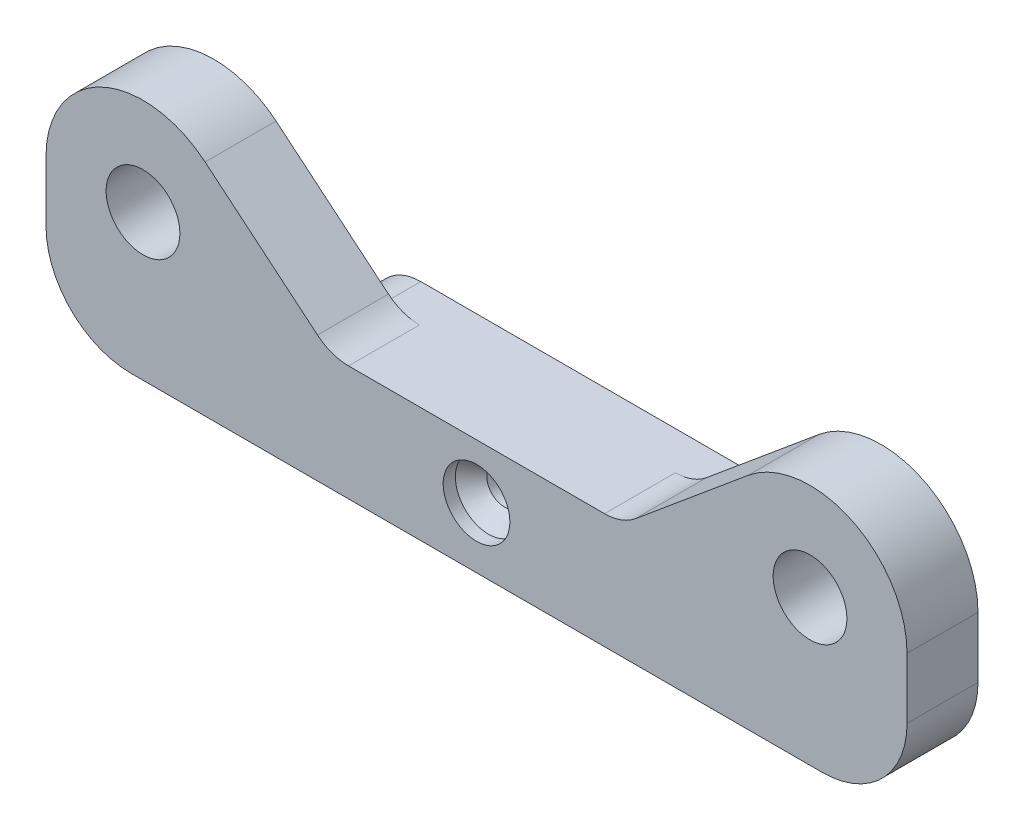
from build123d import *
from build123d.topology import SkipClean

# Parameters (mm, degrees)
BOSS_EXTRUDE1_DEPTH          = 9
BOSS_EXTRUDE1_DEPTH_BACK     = 9
SKETCH1_W                    = 67.5
SKETCH1_H                    = 7
SKETCH2_W                    = 15
SKETCH2_H                    = 6.3
CUT_EXTRUDE1_DEPTH           = 36.623903492
SKETCH3_W                    = 12.5
SKETCH3_H                    = 5.85
BOSS_EXTRUDE2_DEPTH          = 10
CUT_EXTRUDE2_DEPTH           = 22
CUT_EXTRUDE2_DEPTH_BACK      = 24.5
SKETCH4_R                    = 3.04
CUT_EXTRUDE3_DEPTH           = 5
SKETCH6_R                    = 6.2
CUT_EXTRUDE4_DEPTH           = 1
MIRROR2_COPY_1_SKETCH_R      = 6.2
MIRROR2_COPY_1_DEPTH         = 1
SKETCH7_W                    = 12.5
SKETCH7_H                    = 8.5
CUT_EXTRUDE5_DEPTH           = 1
MIRROR5_COPY_1_SKETCH_W      = 12.5
MIRROR5_COPY_1_SKETCH_H      = 8.5
MIRROR5_COPY_1_DEPTH         = 1
TAP_DRILL_FOR_M2_TAP1_D      = 1.6
CUT_EXTRUDE6_DEPTH           = 27
SKETCH12_W                   = 73.606041854
SKETCH12_H                   = 30.436261762
CUT_EXTRUDE7_DEPTH           = 22
F_2_0_2_DIAMETER_HOLE1_D     = 2
F_2_0_2_DIAMETER_HOLE1_DEPTH = 30.5
F_2_0_2_DIAMETER_HOLE2_D     = 2
F_2_0_2_DIAMETER_HOLE2_DEPTH = 16
F_2_0_2_DIAMETER_HOLE2_TIP   = 0.600860619
BOSS_EXTRU_1_START           = 1
ESQUISSE2_R                  = 3.04
BOSS_EXTRU_1_DEPTH           = 1
BOSS_EXTRU_3_START           = -5.85
ESQUISSE5_R                  = 0.8
BOSS_EXTRU_3_DEPTH           = 5.85
BOSS_EXTRU_4_START           = -9
ESQUISSE6_R                  = 0.8
BOSS_EXTRU_4_DEPTH           = 9
BOSS_EXTRUDE3_DEPTH          = 1.5
BOSS_EXTRUDE4_DEPTH          = 1
BOSS_EXTRUDE5_DEPTH          = 5.85
CHAMFER1_SIZE                = 3.5
BOSS_EXTRUDE6_START          = -2
SKETCH27_R                   = 1
BOSS_EXTRUDE6_DEPTH          = 2
SKETCH28_R                   = 8
SKETCH28_R_2                 = 3.04
BOSS_EXTRUDE7_DEPTH          = 5.85
SKETCH29_W                   = 1.75
SKETCH29_H                   = 12
BOSS_EXTRUDE8_DEPTH          = 5.85
BOSS_EXTRUDE9_DEPTH          = 5.85
FILLET1_R                    = 4
FILLET2_R                    = 7
FILLET4_R                    = 4


with BuildPart() as part:
    # Sketch1 → Boss-Extrude1 (new, two sides: drawn at the far end of the back side and taken through both)
    with BuildSketch(Plane.XY.offset(-BOSS_EXTRUDE1_DEPTH_BACK)):
        Rectangle(SKETCH1_W, SKETCH1_H)
    extrude(amount=BOSS_EXTRUDE1_DEPTH + BOSS_EXTRUDE1_DEPTH_BACK)

    # Sketch2 → Cut-Extrude1 (cut, through all)
    with BuildSketch(Plane(origin=(0, 3.5, 0), x_dir=(1, 0, 0), z_dir=(0, 1, 0))):
        with Locations((-26.25, 0)):
            Rectangle(SKETCH2_W, SKETCH2_H)
        with Locations((26.25, 0)):
            Rectangle(SKETCH2_W, SKETCH2_H)
    extrude(amount=-CUT_EXTRUDE1_DEPTH, mode=Mode.SUBTRACT)

    # Sketch3 → Boss-Extrude2 (add)
    with BuildSketch(Plane(origin=(0, 3.5, 0), x_dir=(1, 0, 0), z_dir=(0, 1, 0))):
        with Locations((-27.5, 6.075)):
            Rectangle(SKETCH3_W, SKETCH3_H)
        with Locations((-27.5, -6.075)):
            Rectangle(SKETCH3_W, SKETCH3_H)
        with Locations((27.5, -6.075)):
            Rectangle(SKETCH3_W, SKETCH3_H)
        with Locations((27.5, 6.075)):
            Rectangle(SKETCH3_W, SKETCH3_H)
    extrude(amount=BOSS_EXTRUDE2_DEPTH)

    # Sketch4 → Cut-Extrude2 (cut, two sides: drawn at the far end of the back side and taken through both)
    with BuildSketch(Plane.XY.offset(-CUT_EXTRUDE2_DEPTH_BACK)):
        with Locations((-27.5, 7)):
            Circle(SKETCH4_R)
        with Locations((27.5, 7)):
            Circle(SKETCH4_R)
    extrude(amount=CUT_EXTRUDE2_DEPTH + CUT_EXTRUDE2_DEPTH_BACK, mode=Mode.SUBTRACT)

    # Sketch5 → Cut-Extrude3 (cut)
    with BuildSketch(Plane.XY):
        Polygon((15, 3.5), (36.256888292, -2.195766051), (36.256888292, 13.5), (15, 13.5), align=None)
    extrude(amount=-CUT_EXTRUDE3_DEPTH, mode=Mode.SUBTRACT)

    # Sketch6 → Cut-Extrude4 (cut)
    with BuildSketch(Plane.XY.offset(9)):
        with Locations((27.5, 7)):
            Circle(SKETCH6_R)
    cut_extrude4 = extrude(amount=-CUT_EXTRUDE4_DEPTH, mode=Mode.SUBTRACT)

    # Mirror1: Cut-Extrude4 across plane
    add(cut_extrude4.mirror(Plane.XY), mode=Mode.SUBTRACT)

    # Mirror2: Cut-Extrude4 across plane
    add(cut_extrude4.mirror(Plane(origin=(0, 0, 0), x_dir=(0, 0, 1), z_dir=(1, 0, 0))), mode=Mode.SUBTRACT)

    # Mirror2 copy 1 sketch → Mirror2 copy 1 (cut)
    with BuildSketch(Plane(origin=(0, 0, -9), x_dir=(-1, 0, 0), z_dir=(0, 0, -1))):
        with Locations((27.5, 7)):
            Circle(MIRROR2_COPY_1_SKETCH_R)
    extrude(amount=-MIRROR2_COPY_1_DEPTH, mode=Mode.SUBTRACT)

    # Sketch7 → Cut-Extrude5 (cut)
    with BuildSketch(Plane.XY.offset(9)):
        with Locations((-27.5, 9.25)):
            Rectangle(SKETCH7_W, SKETCH7_H)
    cut_extrude5 = extrude(amount=-CUT_EXTRUDE5_DEPTH, mode=Mode.SUBTRACT)

    # Mirror3: Cut-Extrude5 across plane
    add(cut_extrude5.mirror(Plane(origin=(0, 0, 0), x_dir=(0, 0, 1), z_dir=(1, 0, 0))), mode=Mode.SUBTRACT)

    # Mirror5: Cut-Extrude5 across plane
    add(cut_extrude5.mirror(Plane.XY), mode=Mode.SUBTRACT)

    # Mirror5 copy 1 sketch → Mirror5 copy 1 (cut)
    with BuildSketch(Plane(origin=(0, 0, -9), x_dir=(-1, 0, 0), z_dir=(0, 0, -1))):
        with Locations((-27.5, 9.25)):
            Rectangle(MIRROR5_COPY_1_SKETCH_W, MIRROR5_COPY_1_SKETCH_H)
    extrude(amount=-MIRROR5_COPY_1_DEPTH, mode=Mode.SUBTRACT)

    # Tap Drill for M2 Tap1 (through all)
    with Locations(Plane.XY.offset(9)):
        with Locations((-25, 0), (0, 0), (25, 0)):
            Hole(TAP_DRILL_FOR_M2_TAP1_D / 2)

    # Sketch11 → Cut-Extrude6 (cut)
    with BuildSketch(Plane.XY.offset(9)):
        with BuildLine():
            Line((-33.75, 6.999999588), (-33.75, 21.221242017))
            Line((-33.75, 21.221242017), (-21.25, 21.221242017))
            Line((-21.25, 21.221242017), (-21.25, 6.999999588))
            ThreePointArc((-21.25, 6.999999588), (-27.5, 13.25), (-33.75, 6.999999588))
        make_face()
    cut_extrude6 = extrude(amount=-CUT_EXTRUDE6_DEPTH, mode=Mode.SUBTRACT)

    # Mirror6: Cut-Extrude6 across plane
    add(cut_extrude6.mirror(Plane(origin=(0, 0, 0), x_dir=(0, 0, 1), z_dir=(1, 0, 0))), mode=Mode.SUBTRACT)

    # Sketch12 → Cut-Extrude7 (cut)
    with BuildSketch(Plane.XY):
        Rectangle(SKETCH12_W, SKETCH12_H)
    extrude(amount=-CUT_EXTRUDE7_DEPTH, mode=Mode.SUBTRACT)

    # Ø2.0 (2) Diameter Hole1
    with Locations(Plane.XY.offset(9)):
        with Locations((-15, 0)):
            Hole(F_2_0_2_DIAMETER_HOLE1_D / 2, depth=F_2_0_2_DIAMETER_HOLE1_DEPTH)

    # Ø2.0 (2) Diameter Hole2
    with Locations(Plane.XY.offset(9)):
        with Locations((15, 0)):
            Hole(F_2_0_2_DIAMETER_HOLE2_D / 2, depth=F_2_0_2_DIAMETER_HOLE2_DEPTH)
            with Locations((0, 0, -(F_2_0_2_DIAMETER_HOLE2_DEPTH + F_2_0_2_DIAMETER_HOLE2_TIP / 2))):  # 118° drill point
                Cone(0, F_2_0_2_DIAMETER_HOLE2_D / 2, F_2_0_2_DIAMETER_HOLE2_TIP, mode=Mode.SUBTRACT)

    # Esquisse2 → Boss.-Extru.1 (add)
    # profile 1 of 2: a face of its own
    with SkipClean():  # the faces are left unmerged after this step: merging them gives an invalid solid
        with BuildSketch(Plane.XY.offset(8).offset(BOSS_EXTRU_1_START)):
            with BuildLine():
                ThreePointArc((21.6314397, 5), (26.48636147, 13.116578858), (33.7, 7))
                ThreePointArc((33.7, 7), (33.616578858, 5.98636147), (33.3685603, 5))
                Line((33.3685603, 5), (33.75, 5))
                Line((33.75, 5), (33.75, 6.999999588))
                ThreePointArc((33.75, 6.999999588), (27.5, 13.25), (21.25, 6.999999588))
                Line((21.25, 6.999999588), (21.25, 5))
                Line((21.25, 5), (21.6314397, 5))
            make_face()
        # profile 2 of 2: a face of its own
        with BuildSketch(Plane.XY.offset(8).offset(BOSS_EXTRU_1_START)):
            with BuildLine():
                ThreePointArc((33.3685603, 5), (33.616578858, 5.98636147), (33.7, 7))
                ThreePointArc((33.7, 7), (26.48636147, 13.116578858), (21.6314397, 5))
                ThreePointArc((21.6314397, 5), (27.5, 0.8), (33.3685603, 5))
            make_face()
            with Locations((27.5, 7)):
                Circle(ESQUISSE2_R, mode=Mode.SUBTRACT)
        boss_extru_1 = extrude(amount=-BOSS_EXTRU_1_DEPTH)

    # Symétrie1: Boss.-Extru.1 across plane
    with SkipClean():  # the faces are left unmerged after this step: merging them gives an invalid solid
        add(boss_extru_1.mirror(Plane(origin=(0, 0, 0), x_dir=(0, 0, 1), z_dir=(1, 0, 0))))

    # Esquisse5 → Boss.-Extru.3 (add)
    with SkipClean():  # the faces are left unmerged after this step: merging them gives an invalid solid
        with BuildSketch(Plane.XY.offset(9).offset(BOSS_EXTRU_3_START)):
            with Locations((-25, 0)):
                Circle(ESQUISSE5_R)
            with Locations((25, 0)):
                Circle(ESQUISSE5_R)
        extrude(amount=BOSS_EXTRU_3_DEPTH)

    # Esquisse6 → Boss.-Extru.4 (add)
    with SkipClean():  # the faces are left unmerged after this step: merging them gives an invalid solid
        with BuildSketch(Plane.XY.offset(9).offset(BOSS_EXTRU_4_START)):
            Circle(ESQUISSE6_R)
        extrude(amount=BOSS_EXTRU_4_DEPTH)

    # Sketch22 → Boss-Extrude3 (add)
    with SkipClean():  # the faces are left unmerged after this step: merging them gives an invalid solid
        with BuildSketch(Plane.XZ.offset(3.5)):
            Polygon((-18.75, 0), (18.75, 0), (18.75, 3.15), (33.75, 3.15), (33.75, 9), (-33.75, 9), (-33.75, 3.15), (-18.75, 3.15), align=None)
        extrude(amount=BOSS_EXTRUDE3_DEPTH)

    # Sketch23 → CSK for M2.5 Countersunk Flat Head Screw1 (revolve, cut)
    with SkipClean():  # the faces are left unmerged after this step: merging them gives an invalid solid
        with BuildSketch(Plane(origin=(0, 0, 9), x_dir=(0, -1, 0), z_dir=(1, 0, 0))):
            Polygon((0, 0), (0, 9), (1.45, 9), (1.45, 2.3), (2.75, 1), (2.75, 0), align=None)
        revolve(axis=Axis((0, 0, 15.35), (0, 0, -1)), mode=Mode.SUBTRACT)

    # Sketch25 → Boss-Extrude4 (add)
    with SkipClean():  # the faces are left unmerged after this step: merging them gives an invalid solid
        with BuildSketch(Plane(origin=(0, 3.5, 0), x_dir=(1, 0, 0), z_dir=(0, 1, 0))):
            Polygon((18.75, 0), (-18.75, 0), (-18.75, -3.15), (-21.25, -3.15), (-21.25, -9), (21.25, -9), (21.25, -3.15), (18.75, -3.15), align=None)
        extrude(amount=BOSS_EXTRUDE4_DEPTH)

    # Sketch26 → Boss-Extrude5 (add)
    with SkipClean():  # the faces are left unmerged after this step: merging them gives an invalid solid
        with BuildSketch(Plane(origin=(0, 0, 3.15), x_dir=(-1, 0, 0), z_dir=(0, 0, -1))):
            Polygon((-24.13078786, 12.264115268), (-12, 4.5), (-21.25, 4.5), align=None)
            Polygon((21.25, 4.5), (24.13078786, 12.264115268), (12, 4.5), align=None)
        extrude(amount=-BOSS_EXTRUDE5_DEPTH)

    # Chamfer1
    # the kernel refuses this chamfer: 3.5 mm, written as the material it takes off along each edge
    with BuildSketch(Plane(origin=(-18.75, -5, 3.15), x_dir=(0.9996219169112968, -0.027495876610586112, 0), z_dir=(0, 0, -1)), Plane(origin=(-18.75, 4.5, -9.000890458), x_dir=(0.9996219169112968, 0.027495876610586372, 0), z_dir=(0, 0, 1))) as chamfer1_piece_1:
        Polygon((CHAMFER1_SIZE * 0.999621916911, -CHAMFER1_SIZE * 0.0274958766106), (-CHAMFER1_SIZE * 0.0274958766106, -CHAMFER1_SIZE * 0.999621916911), (0, 0), align=None)
    extrude(amount=12.150890458, mode=Mode.SUBTRACT)
    with BuildSketch(Plane(origin=(18.75, -5, -9.000890458), x_dir=(0.02749587661058612, 0.9996219169112968, 0), z_dir=(0, 0, 1)), Plane(origin=(18.75, 4.5, 3.15), x_dir=(0.02749587661058612, -0.9996219169112968, 0), z_dir=(0, 0, -1))) as chamfer1_piece_2:
        Polygon((CHAMFER1_SIZE * 0.999621916911, CHAMFER1_SIZE * 0.0274958766106), (-CHAMFER1_SIZE * 0.0274958766106, CHAMFER1_SIZE * 0.999621916911), (0, 0), align=None)
    extrude(amount=12.150890458, mode=Mode.SUBTRACT)

    # Sketch27 → Boss-Extrude6 (add)
    with BuildSketch(Plane.XY.offset(9).offset(BOSS_EXTRUDE6_START)):
        with Locations((-15, 0)):
            Circle(SKETCH27_R)
        with Locations((15, 0)):
            Circle(SKETCH27_R)
    extrude(amount=BOSS_EXTRUDE6_DEPTH)

    # Sketch28 → Boss-Extrude7 (add)
    # profile 1 of 2: a face of its own
    with BuildSketch(Plane(origin=(0, 0, 3.15), x_dir=(-1, 0, 0), z_dir=(0, 0, -1))):
        with Locations((-27.5, 7)):
            Circle(SKETCH28_R)
        with Locations(Location((-27.5, 7, 0), (0, 0, 180))):
            Circle(SKETCH28_R_2, mode=Mode.SUBTRACT)
    # profile 2 of 2: a face of its own
    with BuildSketch(Plane(origin=(0, 0, 3.15), x_dir=(-1, 0, 0), z_dir=(0, 0, -1))):
        with Locations((27.5, 7)):
            Circle(SKETCH28_R)
        with Locations(Location((27.5, 7, 0), (0, 0, 180))):
            Circle(SKETCH28_R_2, mode=Mode.SUBTRACT)
    extrude(amount=-BOSS_EXTRUDE7_DEPTH)

    # Sketch29 → Boss-Extrude8 (add)
    with BuildSketch(Plane(origin=(0, 0, 3.15), x_dir=(-1, 0, 0), z_dir=(0, 0, -1))):
        with Locations((-34.625, 1)):
            Rectangle(SKETCH29_W, SKETCH29_H)
        with Locations((34.625, 1)):
            Rectangle(SKETCH29_W, SKETCH29_H)
    extrude(amount=-BOSS_EXTRUDE8_DEPTH)

    # Sketch31 → Boss-Extrude9 (add)
    with BuildSketch(Plane(origin=(0, 0, 3.15), x_dir=(-1, 0, 0), z_dir=(0, 0, -1))):
        Polygon((-22.379573543, 13.146644035), (-12, 4.5), (-19.924763055, 9.572116877), align=None)
        Polygon((19.924763055, 9.572116877), (22.379573543, 13.146644035), (12, 4.5), align=None)
    extrude(amount=-BOSS_EXTRUDE9_DEPTH)

    # Fillet1
    fillet1_edges = [part.edges().sort_by_distance(p)[0] for p in [
        (12, 4.5, 6.075),
        (-12, 4.5, 6.075),
    ]]
    fillet(fillet1_edges, radius=FILLET1_R)

    # Fillet2
    # the kernel refuses this fillet: 7 mm, written as the material it takes off along each edge
    with BuildSketch(Plane(origin=(35.5, -5, -14.35), x_dir=(0, 1, 0), z_dir=(0, 0, 1))) as fillet2_piece_1:
        with BuildLine():
            CenterArc((FILLET2_R, FILLET2_R), FILLET2_R, 180, 90)
            Line((0, FILLET2_R), (0, 0))
            Line((0, 0), (FILLET2_R, 0))
        make_face()
    extrude(amount=40.85, mode=Mode.SUBTRACT)
    with BuildSketch(Plane(origin=(-35.5, -5, -14.35), x_dir=(0, 1, 0), z_dir=(0, 0, 1))) as fillet2_piece_2:
        with BuildLine():
            CenterArc((FILLET2_R, -FILLET2_R), FILLET2_R, 90, 90)
            Line((0, -FILLET2_R), (0, 0))
            Line((0, 0), (FILLET2_R, 0))
        make_face()
    extrude(amount=40.85, mode=Mode.SUBTRACT)

    # Fillet4
    # the kernel refuses this fillet: 4 mm, written as the material it takes off along each edge
    with BuildSketch(Plane(origin=(-18.75, -1.5, 3.15), x_dir=(0.7071067811862645, -0.7071067811868306, 0), z_dir=(0, 0, -1)), Plane(origin=(-18.75, 1, -4.142135624), x_dir=(0.7071067811862647, 0.7071067811868305, 0), z_dir=(0, 0, 1)), Plane(origin=(-15.25, 4.5, -4.142135624), x_dir=(1, 0, 0), z_dir=(0, 0, 1)), Plane(origin=(-15.25, -5, 3.15), x_dir=(1, 0, 0), z_dir=(0, 0, -1)), Plane(origin=(15.25, -5, -4.142135624), x_dir=(-1, 0, 0), z_dir=(0, 0, 1)), Plane(origin=(18.75, -1.5, -4.142135624), x_dir=(-0.7071067811868305, -0.7071067811862647, 0), z_dir=(0, 0, 1))) as fillet4_piece_1:
        with BuildLine():
            CenterArc((FILLET4_R * 0.414213562373, -FILLET4_R), FILLET4_R, 90, 45)
            Line((-FILLET4_R * 0.292893218813, -FILLET4_R * 0.292893218813), (0, 0))
            Line((0, 0), (FILLET4_R * 0.414213562373, 0))
        make_face()
    extrude(amount=7.292135624, mode=Mode.SUBTRACT)
    with BuildSketch(Plane(origin=(18.75, 1, 3.15), x_dir=(0, -1, 0), z_dir=(0, 0, -1)), Plane(origin=(15.25, 4.5, 3.15), x_dir=(0.7071067811868307, -0.7071067811862646, 0), z_dir=(0, 0, -1))) as fillet4_piece_2:
        with BuildLine():
            CenterArc((FILLET4_R * 0.414213562374, FILLET4_R), FILLET4_R, 225, 45)
            Line((-FILLET4_R * 0.292893218813, FILLET4_R * 0.292893218814), (0, 0))
            Line((0, 0), (FILLET4_R * 0.414213562373, 0))
        make_face()
    extrude(amount=7.292135624, mode=Mode.SUBTRACT)


solid = part.part
